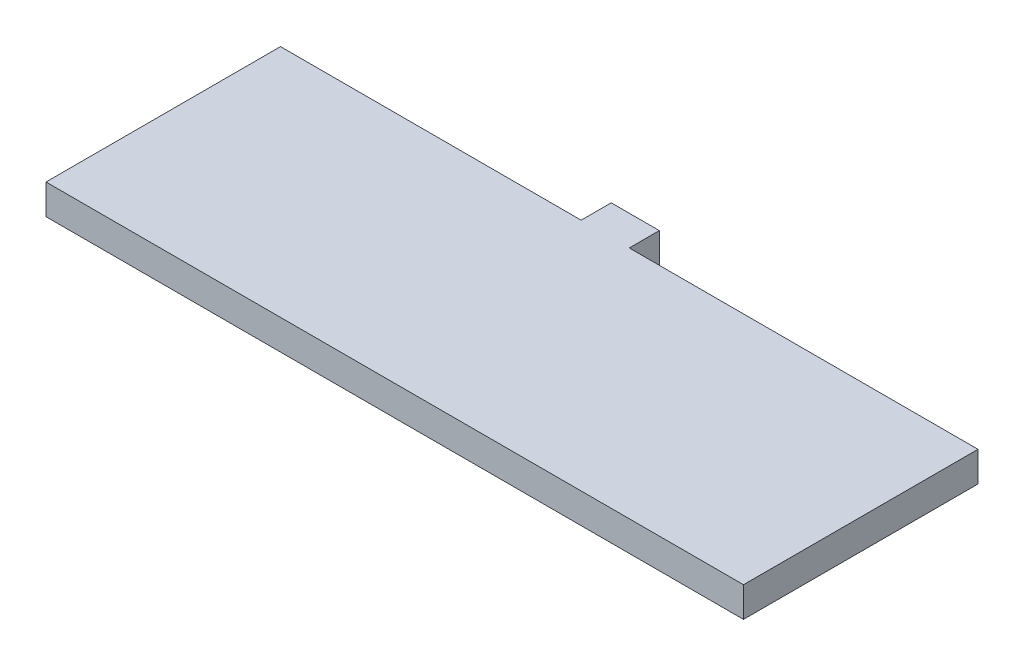
from build123d import *

# Parameters (mm, degrees)
BOSS_EXTRUDE1_DEPTH = 3.175


with BuildPart() as part:
    # Sketch2 → Boss-Extrude1 (new body)
    with BuildSketch(Plane(origin=(0, 0, 0), x_dir=(1, 0, 0), z_dir=(0, 1, 0))):
        Polygon((-5.08, 0), (-36.83, 0), (-36.83, -24.765), (36.83, -24.765), (36.83, 0), (0, 0), (0, 3.175), (-5.08, 3.175), align=None)
    extrude(amount=BOSS_EXTRUDE1_DEPTH)


solid = part.part
